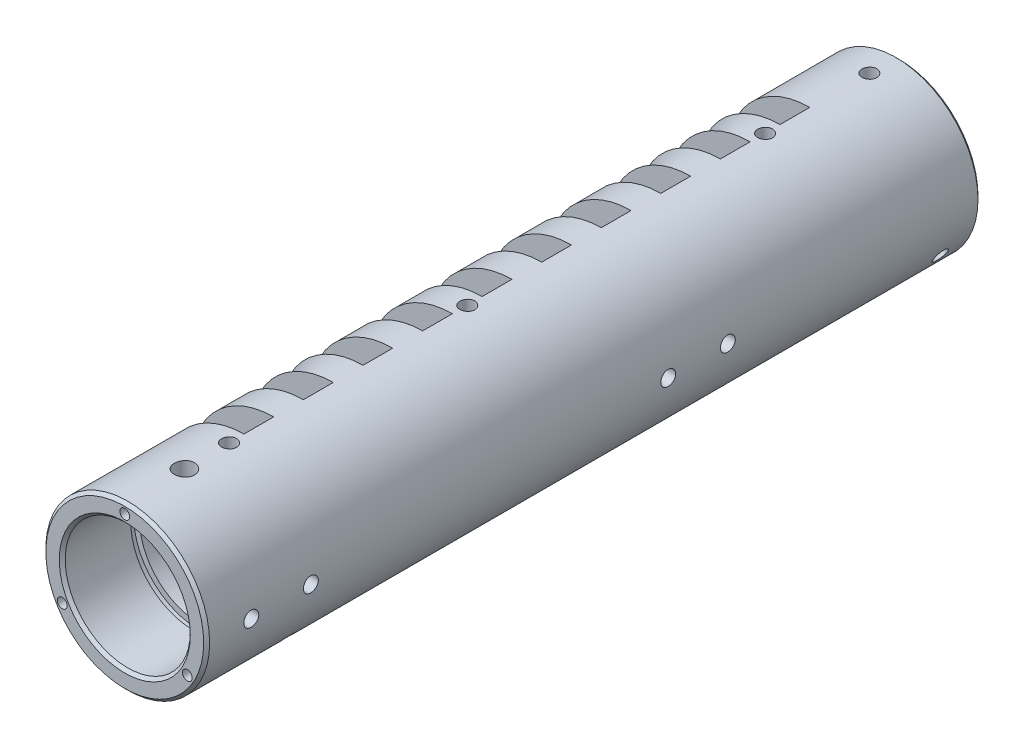
from build123d import *

# Parameters (mm, degrees)
SKETCH_1_R                       = 27.5
EXTRUDE_1_DEPTH                  = 260
SKETCH_2_R                       = 15.5
CUT_EXTRUDE_1_DEPTH              = 5
SKETCH_3_R                       = 20
CUT_EXTRUDE_2_DEPTH              = 258.948638298
SKETCH_4_R                       = 21
CUT_EXTRUDE_3_DEPTH              = 25
SKETCH_5_R                       = 22
CUT_EXTRUDE_4_DEPTH              = 2
SKETCH_6_W                       = 37.675303075
SKETCH_6_H                       = 33.272803296
CUT_EXTRUDE_6_DEPTH              = 5
PATTERN_LINEAR_1_COUNT           = 10
PATTERN_LINEAR_1_PITCH           = 20
HOLE_WIZARD_M8_1_REACH           = 249.752
HOLE_WIZARD_M8_1_BORE_R          = 3.4
HOLE_WIZARD_M6_1_REACH           = 235.251
HOLE_WIZARD_M6_1_BORE_R          = 2.5
PATTERN_CIRCULAR_1_COUNT         = 2
PATTERN_CIRCULAR_1_ANGLE         = 90
F_1_THE_OTHER_WAY_COUNT          = 2
F_1_THE_OTHER_WAY_ANGLE          = 90
PATTERN_CIRCULAR_2_COUNT         = 2
PATTERN_CIRCULAR_2_ANGLE         = 135
HOLE_WIZARD_M6_3_D               = 5
HOLE_WIZARD_M6_3_DEPTH           = 6.5
HOLE_WIZARD_M6_4_D               = 5
HOLE_WIZARD_M6_4_DEPTH           = 7.5
HOLE_WIZARD_M6_5_D               = 5
HOLE_WIZARD_M6_5_DEPTH           = 7.5
HOLE_WIZARD_M6_6_REACH           = 259.451
HOLE_WIZARD_M6_6_BORE_R          = 2.5
PATTERN_CIRCULAR_3_COUNT         = 3
HOLE_WIZARD_M6_7_REACH           = 225.621
HOLE_WIZARD_M6_7_BORE_R          = 2.5
PATTERN_CIRCULAR_4_COUNT         = 2
PATTERN_CIRCULAR_4_ANGLE         = 90
PATTERN_LINEAR_3_COUNT           = 2
PATTERN_LINEAR_3_PITCH           = 100
PATTERN_LINEAR_3_COPY_1_REACH    = 225.621
PATTERN_LINEAR_3_COPY_1_SKETCH_R = 2.5
CHAMFER_1_SIZE                   = 1


# Read off the part's stored shape, not the designer's step: M4 螺纹孔1
with BuildPart() as part:
    # 草图1 → 凸台-拉伸1 (new body)
    with BuildSketch(Plane.XY):
        Circle(SKETCH_1_R)
    extrude(amount=EXTRUDE_1_DEPTH)

    # 草图2 → 切除-拉伸1 (cut)
    with BuildSketch(Plane(origin=(0, 0, 0), x_dir=(-1, 0, 0), z_dir=(0, 0, -1))):
        Circle(SKETCH_2_R)
    extrude(amount=-CUT_EXTRUDE_1_DEPTH, mode=Mode.SUBTRACT)

    # 草图3 → 切除-拉伸2 (cut, through all)
    with BuildSketch(Plane(origin=(0, 0, 5), x_dir=(-1, 0, 0), z_dir=(0, 0, -1))):
        Circle(SKETCH_3_R)
    extrude(amount=-CUT_EXTRUDE_2_DEPTH, mode=Mode.SUBTRACT)

    # 草图4 → 切除-拉伸3 (cut)
    with BuildSketch(Plane.XY.offset(260)):
        Circle(SKETCH_4_R)
    extrude(amount=-CUT_EXTRUDE_3_DEPTH, mode=Mode.SUBTRACT)

    # 草图5 → 切除-拉伸4 (cut)
    with BuildSketch(Plane.XY.offset(235)):
        Circle(SKETCH_5_R)
    extrude(amount=CUT_EXTRUDE_4_DEPTH, mode=Mode.SUBTRACT)

    # 草图6 → 切除-拉伸6 (cut, symmetric)
    with BuildSketch(Plane.XY.offset(215)):
        with Locations((-18.837651538, 16.636401648)):
            Rectangle(SKETCH_6_W, SKETCH_6_H)
    cut_extrude_6 = extrude(amount=CUT_EXTRUDE_6_DEPTH, both=True, mode=Mode.SUBTRACT)

    # 草图8 → Ø4.0mm 暗销孔1 (revolve, cut)
    with BuildSketch(Plane(origin=(0, 23.75, 215), x_dir=(0, 0, 1), z_dir=(0, 1, 0))):
        Polygon((0, 0), (0, 6), (2, 4.798278762), (2, 0), align=None)
    f_4_0mm_1 = revolve(axis=Axis((-6.35, 23.75, 215), (1, 0, 0)), mode=Mode.SUBTRACT)

    # 草图10 → Ø4.0mm 暗销孔2 (revolve, cut)
    with BuildSketch(Plane(origin=(-23.75, 0, 215), x_dir=(0, 0, 1), z_dir=(1, 0, 0))):
        Polygon((0, 0), (0, 6), (2, 4.798278762), (2, 0), align=None)
    f_4_0mm_2 = revolve(axis=Axis((-23.75, 6.35, 215), (0, -1, 0)), mode=Mode.SUBTRACT)

    # 阵列(线性)1: 切除-拉伸6, Ø4.0mm 暗销孔1, Ø4.0mm 暗销孔2 ×10
    with Locations(*[(0, 0, -i * PATTERN_LINEAR_1_PITCH) for i in range(1, PATTERN_LINEAR_1_COUNT)]):
        add(cut_extrude_6, mode=Mode.SUBTRACT)
        add(f_4_0mm_1, mode=Mode.SUBTRACT)
        add(f_4_0mm_2, mode=Mode.SUBTRACT)

    # M8 螺纹孔1 bore (on position points) → M8 螺纹孔1 (cut, up to next)
    with BuildSketch(Plane(origin=(0, 27.5, 240), x_dir=(1, 0, 0), z_dir=(0, 1, 0)), mode=Mode.PRIVATE) as hole_wizard_m8_1_sk1:
        Circle(HOLE_WIZARD_M8_1_BORE_R)
    hole_wizard_m8_1_tool1 = extrude(hole_wizard_m8_1_sk1.sketch, amount=-HOLE_WIZARD_M8_1_REACH, mode=Mode.PRIVATE) & part.part
    add(hole_wizard_m8_1_tool1.solids().sort_by_distance((0, 27.5, 240))[0], mode=Mode.SUBTRACT)

    # M6 螺纹孔1 bore (on position points) → M6 螺纹孔1 (cut, up to next)
    with BuildSketch(Plane(origin=(0, 27.5, 225), x_dir=(1, 0, 0), z_dir=(0, 1, 0)), mode=Mode.PRIVATE) as hole_wizard_m6_1_sk1:
        Circle(HOLE_WIZARD_M6_1_BORE_R)
    hole_wizard_m6_1_tool1 = extrude(hole_wizard_m6_1_sk1.sketch, amount=-HOLE_WIZARD_M6_1_REACH, mode=Mode.PRIVATE) & part.part
    hole_wizard_m6_1 = hole_wizard_m6_1_tool1.solids().sort_by_distance((0, 27.5, 225))[0]
    add(hole_wizard_m6_1, mode=Mode.SUBTRACT)

    # 阵列(圆周)1: M6 螺纹孔1 ×2 about axis
    pattern_circular_1_axis = Axis((0, 0, 260), (0, 0, -1))
    for i in range(1, PATTERN_CIRCULAR_1_COUNT):
        add(hole_wizard_m6_1.rotate(pattern_circular_1_axis, i * PATTERN_CIRCULAR_1_ANGLE / (PATTERN_CIRCULAR_1_COUNT - 1)), mode=Mode.SUBTRACT)

    # 1 the other way: M6 螺纹孔1 ×2 about axis
    f_1_the_other_way_axis = Axis((0, 0, 260), (0, 0, 1))
    for i in range(1, F_1_THE_OTHER_WAY_COUNT):
        add(hole_wizard_m6_1.rotate(f_1_the_other_way_axis, i * F_1_THE_OTHER_WAY_ANGLE / (F_1_THE_OTHER_WAY_COUNT - 1)), mode=Mode.SUBTRACT)

    # 阵列(圆周)2: M6 螺纹孔1 ×2 about axis
    pattern_circular_2_axis = Axis((0, 0, 260), (0, 0, -1))
    for i in range(1, PATTERN_CIRCULAR_2_COUNT):
        add(hole_wizard_m6_1.rotate(pattern_circular_2_axis, i * PATTERN_CIRCULAR_2_ANGLE / (PATTERN_CIRCULAR_2_COUNT - 1)), mode=Mode.SUBTRACT)

    # M6 螺纹孔3
    with Locations(Plane(origin=(21, 0, 245), x_dir=(0, 0, -1), z_dir=(-1, 0, 0))):
        with Locations((0, 0)):
            Hole(HOLE_WIZARD_M6_3_D / 2, depth=HOLE_WIZARD_M6_3_DEPTH)

    # M6 螺纹孔4
    with Locations(Plane(origin=(20, 0, 85), x_dir=(0, -1, 0), z_dir=(-1, 0, 0))):
        with Locations((0, 0), (0, 20)):
            Hole(HOLE_WIZARD_M6_4_D / 2, depth=HOLE_WIZARD_M6_4_DEPTH)

    # M6 螺纹孔5
    with Locations(Plane(origin=(0, -20, 105), x_dir=(1, 0, 0), z_dir=(0, 1, 0))):
        with Locations((0, 0)):
            Hole(HOLE_WIZARD_M6_5_D / 2, depth=HOLE_WIZARD_M6_5_DEPTH)

    # M6 螺纹孔6 bore (on position points) → M6 螺纹孔6 (cut, up to next)
    with BuildSketch(Plane(origin=(0, 27.5, 10), x_dir=(1, 0, 0), z_dir=(0, 1, 0)), mode=Mode.PRIVATE) as hole_wizard_m6_6_sk1:
        Circle(HOLE_WIZARD_M6_6_BORE_R)
    hole_wizard_m6_6_tool1 = extrude(hole_wizard_m6_6_sk1.sketch, amount=-HOLE_WIZARD_M6_6_REACH, mode=Mode.PRIVATE) & part.part
    hole_wizard_m6_6 = hole_wizard_m6_6_tool1.solids().sort_by_distance((0, 27.5, 10))[0]
    add(hole_wizard_m6_6, mode=Mode.SUBTRACT)

    # 阵列(圆周)3: M6 螺纹孔6 ×3 about axis
    pattern_circular_3_axis = Axis((0, 0, 260), (0, 0, -1))
    for i in range(1, PATTERN_CIRCULAR_3_COUNT):
        add(hole_wizard_m6_6.rotate(pattern_circular_3_axis, i * 360 / PATTERN_CIRCULAR_3_COUNT), mode=Mode.SUBTRACT)

    # M6 螺纹孔7 bore (on position points) → M6 螺纹孔7 (cut, up to next)
    with BuildSketch(Plane(origin=(0, 27.5, 45), x_dir=(1, 0, 0), z_dir=(0, 1, 0)), mode=Mode.PRIVATE) as hole_wizard_m6_7_sk1:
        Circle(HOLE_WIZARD_M6_7_BORE_R)
    hole_wizard_m6_7_tool1 = extrude(hole_wizard_m6_7_sk1.sketch, amount=-HOLE_WIZARD_M6_7_REACH, mode=Mode.PRIVATE) & part.part
    hole_wizard_m6_7 = hole_wizard_m6_7_tool1.solids().sort_by_distance((0, 27.5, 45))[0]
    add(hole_wizard_m6_7, mode=Mode.SUBTRACT)

    # 阵列(圆周)4: M6 螺纹孔7 ×2 about axis
    pattern_circular_4_axis = Axis((0, 0, 260), (0, 0, 1))
    for i in range(1, PATTERN_CIRCULAR_4_COUNT):
        add(hole_wizard_m6_7.rotate(pattern_circular_4_axis, i * PATTERN_CIRCULAR_4_ANGLE / (PATTERN_CIRCULAR_4_COUNT - 1)), mode=Mode.SUBTRACT)

    # 阵列(线性)3: M6 螺纹孔7 ×2
    with Locations(*[(0, 0, i * PATTERN_LINEAR_3_PITCH) for i in range(1, PATTERN_LINEAR_3_COUNT)]):
        add(hole_wizard_m6_7, mode=Mode.SUBTRACT)

    # 阵列(线性)3 copy 1 sketch → 阵列(线性)3 copy 1 (cut, up to next)
    with BuildSketch(Plane(origin=(-27.5, 0, 145), x_dir=(0, 1, 0), z_dir=(-1, 0, 0)), mode=Mode.PRIVATE) as pattern_linear_3_copy_1_sk1:
        Circle(PATTERN_LINEAR_3_COPY_1_SKETCH_R)
    pattern_linear_3_copy_1_tool1 = extrude(pattern_linear_3_copy_1_sk1.sketch, amount=-PATTERN_LINEAR_3_COPY_1_REACH, mode=Mode.PRIVATE) & part.part
    add(pattern_linear_3_copy_1_tool1.solids().sort_by_distance((-27.5, 0, 145))[0], mode=Mode.SUBTRACT)

    # 倒角1
    chamfer_1_edges = [part.edges().sort_by_distance(p)[0] for p in [
        (-21, 0, 260),
        (-27.5, 0, 260),
    ]]
    chamfer(chamfer_1_edges, length=CHAMFER_1_SIZE)

    # M4 螺纹孔1 outline → M4 螺纹孔1 (revolve, cut)
    with BuildSketch(Plane.XZ):
        Polygon((27.5, 1), (26.5, 0), (27.5, 0), align=None)
    revolve(axis=Axis((0, 0, 0), (0, 0, 1)), mode=Mode.SUBTRACT)

    # Hole Wizard M4 _1 2 outline → Hole Wizard M4 _1 2 (revolve, cut)
    with BuildSketch(Plane(origin=(-21.001116042, -12.125, 0), x_dir=(1, 0, 0), z_dir=(0, -1, 0))):
        Polygon((0, 260), (0, 248), (1.65, 248.991420021), (1.65, 260), align=None)
    revolve(axis=Axis((-21.001116042, -12.125, 0), (0, 0, 1)), mode=Mode.SUBTRACT)

    # Hole Wizard M4 _1 3 outline → Hole Wizard M4 _1 3 (revolve, cut)
    with BuildSketch(Plane(origin=(21.001116042, -12.125, 0), x_dir=(1, 0, 0), z_dir=(0, -1, 0))):
        Polygon((0, 260), (0, 248), (1.65, 248.991420021), (1.65, 260), align=None)
    revolve(axis=Axis((21.001116042, -12.125, 0), (0, 0, 1)), mode=Mode.SUBTRACT)

    # Hole Wizard M4 _1 4 outline → Hole Wizard M4 _1 4 (revolve, cut)
    with BuildSketch(Plane.XZ.offset(-24.25)):
        Polygon((0, 260), (0, 248), (1.65, 248.991420021), (1.65, 260), align=None)
    revolve(axis=Axis((0, 24.25, 0), (0, 0, 1)), mode=Mode.SUBTRACT)


solid = part.part
